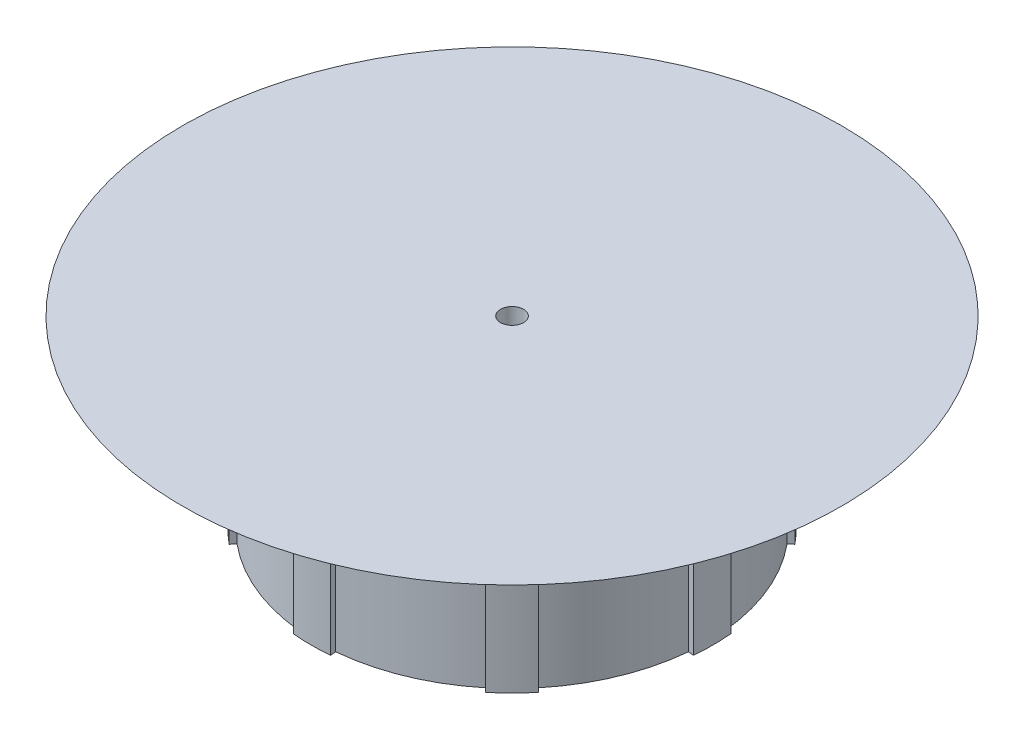
from build123d import *

# Parameters (mm, degrees)
CUT_EXTRUDE1_START = -15.24
CUT_EXTRUDE1_DEPTH = 15.24
SKETCH3_R          = 1.335
CUT_EXTRUDE2_DEPTH = 15.24


with BuildPart() as part:
    # Sketch1 → Revolve1 (revolve)
    with BuildSketch(Plane.XY):
        Polygon((0, 0), (23.2283, 0), (23.2283, 15.24), (38.1, 21.336), (0, 21.336), align=None)
    revolve(axis=Axis((0, 0, 0), (0, 1, 0)))

    # Sketch2 → Cut-Extrude1 (cut)
    with BuildSketch(Plane.XZ.offset(CUT_EXTRUDE1_START)):
        with BuildLine():
            ThreePointArc((-14.413701191, 17.381850141), (-8.641221513, 20.861754172), (-2.09879825, 22.482849959))
            Line((-2.09879825, 22.482849959), (-2.159, 23.127746105))
            ThreePointArc((-2.159, 23.127746105), (-8.889085572, 21.460150945), (-14.827142564, 17.880429645))
            Line((-14.827142564, 17.880429645), (-14.413701191, 17.381850141))
        make_face()
        with BuildLine():
            Line((2.159, 23.127746105), (2.09879825, 22.482849959))
            ThreePointArc((2.09879825, 22.482849959), (8.641221513, 20.861754172), (14.413701191, 17.381850141))
            Line((14.413701191, 17.381850141), (14.827142564, 17.880429645))
            ThreePointArc((14.827142564, 17.880429645), (8.889085572, 21.460150945), (2.159, 23.127746105))
        make_face()
        with BuildLine():
            Line((17.880429645, 14.827142564), (17.381850141, 14.413701191))
            ThreePointArc((17.381850141, 14.413701191), (20.861754172, 8.641221513), (22.482849959, 2.09879825))
            Line((22.482849959, 2.09879825), (23.127746105, 2.159))
            ThreePointArc((23.127746105, 2.159), (21.460150945, 8.889085572), (17.880429645, 14.827142564))
        make_face()
        with BuildLine():
            Line((23.127746105, -2.159), (22.482849959, -2.09879825))
            ThreePointArc((22.482849959, -2.09879825), (20.861754172, -8.641221513), (17.381850141, -14.413701191))
            Line((17.381850141, -14.413701191), (17.880429645, -14.827142564))
            ThreePointArc((17.880429645, -14.827142564), (21.460150945, -8.889085572), (23.127746105, -2.159))
        make_face()
        with BuildLine():
            Line((14.827142564, -17.880429645), (14.413701191, -17.381850141))
            ThreePointArc((14.413701191, -17.381850141), (8.641221513, -20.861754172), (2.09879825, -22.482849959))
            Line((2.09879825, -22.482849959), (2.159, -23.127746105))
            ThreePointArc((2.159, -23.127746105), (8.889085572, -21.460150945), (14.827142564, -17.880429645))
        make_face()
        with BuildLine():
            Line((-2.159, -23.127746105), (-2.09879825, -22.482849959))
            ThreePointArc((-2.09879825, -22.482849959), (-8.641221513, -20.861754172), (-14.413701191, -17.381850141))
            Line((-14.413701191, -17.381850141), (-14.827142564, -17.880429645))
            ThreePointArc((-14.827142564, -17.880429645), (-8.889085572, -21.460150945), (-2.159, -23.127746105))
        make_face()
        with BuildLine():
            Line((-17.880429645, -14.827142564), (-17.381850141, -14.413701191))
            ThreePointArc((-17.381850141, -14.413701191), (-20.861754172, -8.641221513), (-22.482849959, -2.09879825))
            Line((-22.482849959, -2.09879825), (-23.127746105, -2.159))
            ThreePointArc((-23.127746105, -2.159), (-21.460150945, -8.889085572), (-17.880429645, -14.827142564))
        make_face()
        with BuildLine():
            Line((-23.127746105, 2.159), (-22.482849959, 2.09879825))
            ThreePointArc((-22.482849959, 2.09879825), (-20.861754172, 8.641221513), (-17.381850141, 14.413701191))
            Line((-17.381850141, 14.413701191), (-17.880429645, 14.827142564))
            ThreePointArc((-17.880429645, 14.827142564), (-21.460150945, 8.889085572), (-23.127746105, 2.159))
        make_face()
    extrude(amount=CUT_EXTRUDE1_DEPTH, mode=Mode.SUBTRACT)

    # Sketch3 → Cut-Extrude2 (cut)
    with BuildSketch(Plane(origin=(0, 21.336, 0), x_dir=(1, 0, 0), z_dir=(0, 1, 0))):
        Circle(SKETCH3_R)
    extrude(amount=-CUT_EXTRUDE2_DEPTH, mode=Mode.SUBTRACT)


solid = part.part
